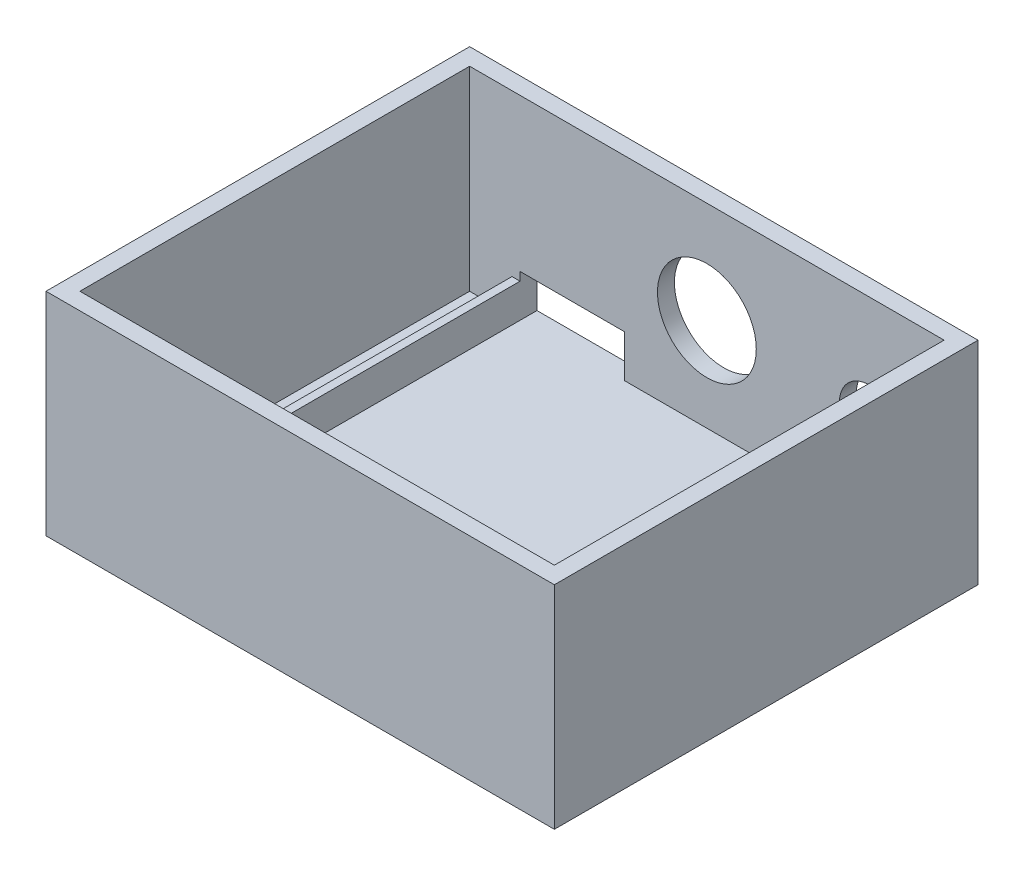
from build123d import *

# Parameters (mm, degrees)
SKETCH1_W           = 120
SKETCH1_H           = 100
BOSS_EXTRUDE1_DEPTH = 50
SKETCH2_W           = 112
SKETCH2_H           = 92
CUT_EXTRUDE1_DEPTH  = 46
SKETCH3_W           = 24.6
SKETCH3_H           = 70
BOSS_EXTRUDE3_DEPTH = 8
SKETCH6_W           = 24.61
SKETCH6_H           = 8
CUT_EXTRUDE4_DEPTH  = 66
SKETCH7_W           = 24.6
SKETCH7_H           = 10
CUT_EXTRUDE6_DEPTH  = 66
SKETCH10_R          = 7
CUT_EXTRUDE9_DEPTH  = 12.5
SKETCH8_R           = 11.662197426
CUT_EXTRUDE10_DEPTH = 10


with BuildPart() as part:
    # Sketch1 → Boss-Extrude1 (new body)
    with BuildSketch(Plane(origin=(0, 0, 0), x_dir=(1, 0, 0), z_dir=(0, 1, 0))):
        with Locations((-10.571222942, 10.082692781)):
            Rectangle(SKETCH1_W, SKETCH1_H)
    extrude(amount=BOSS_EXTRUDE1_DEPTH)

    # Sketch2 → Cut-Extrude1 (cut)
    with BuildSketch(Plane(origin=(0, 50, 0), x_dir=(1, 0, 0), z_dir=(0, 1, 0))):
        with Locations((-10.571222942, 10.082692781)):
            Rectangle(SKETCH2_W, SKETCH2_H)
    extrude(amount=-CUT_EXTRUDE1_DEPTH, mode=Mode.SUBTRACT)

    # Sketch3 → Boss-Extrude3 (add)
    with BuildSketch(Plane(origin=(0, 4, 0), x_dir=(1, 0, 0), z_dir=(0, 1, 0))):
        with Locations((-44.271222942, 25.082692781)):
            Rectangle(SKETCH3_W, SKETCH3_H)
    extrude(amount=BOSS_EXTRUDE3_DEPTH)

    # Sketch6 → Cut-Extrude4 (cut)
    with BuildSketch(Plane.XY.offset(9.917307219)):
        with Locations((-42.369304131, 8)):
            Rectangle(SKETCH6_W, SKETCH6_H)
    extrude(amount=-CUT_EXTRUDE4_DEPTH, mode=Mode.SUBTRACT)

    # Sketch7 → Cut-Extrude6 (cut)
    with BuildSketch(Plane.XY.offset(-56.082692781)):
        with Locations((-42.374304131, 9)):
            Rectangle(SKETCH7_W, SKETCH7_H)
    extrude(amount=-CUT_EXTRUDE6_DEPTH, mode=Mode.SUBTRACT)

    # Sketch10 → Cut-Extrude9 (cut)
    with BuildSketch(Plane(origin=(0, 0, -60.082692781), x_dir=(-1, 0, 0), z_dir=(0, 0, -1))):
        with Locations((-27.728777058, 25)):
            Circle(SKETCH10_R)
    extrude(amount=-CUT_EXTRUDE9_DEPTH, mode=Mode.SUBTRACT)

    # Sketch8 → Cut-Extrude10 (cut)
    with BuildSketch(Plane.XY.offset(-56.082692781)):
        with Locations((-10.571222942, 26)):
            Circle(SKETCH8_R)
    extrude(amount=-CUT_EXTRUDE10_DEPTH, mode=Mode.SUBTRACT)


solid = part.part
